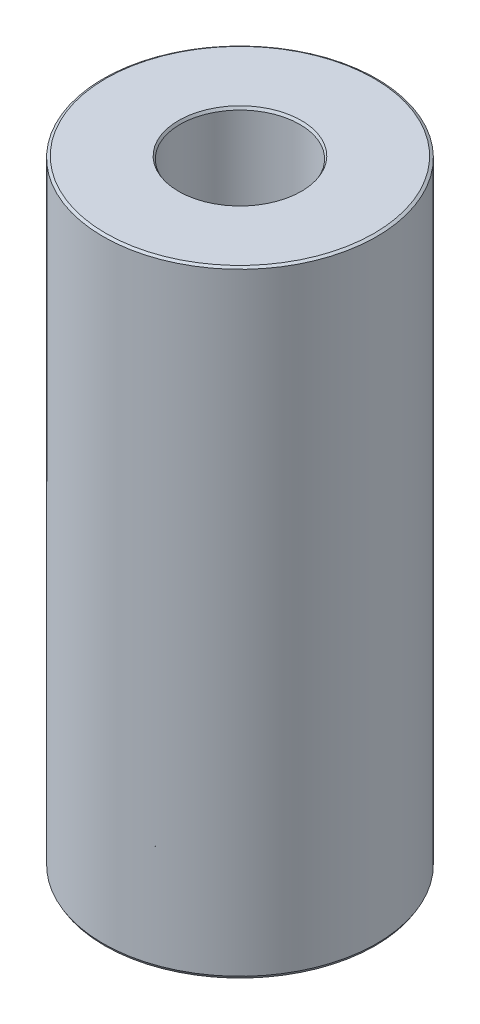
from build123d import *
from OCP.BRepFilletAPI import BRepFilletAPI_MakeChamfer

# Parameters (mm, degrees)
SKETCH1_R           = 32.5
BOSS_EXTRUDE1_DEPTH = 146.475468947
SKETCH2_R           = 14.234179813
CUT_EXTRUDE1_DEPTH  = 154.517305224
CHAMFER1_SIZE       = 0.360597637
CHAMFER1_SIZE2      = 0.624573429


with BuildPart() as part:
    # Sketch1 → Boss-Extrude1 (new body)
    with BuildSketch(Plane(origin=(0, 0, 0), x_dir=(1, 0, 0), z_dir=(0, 1, 0))):
        Circle(SKETCH1_R)
    extrude(amount=BOSS_EXTRUDE1_DEPTH)

    # Sketch2 → Cut-Extrude1 (cut, through all)
    with BuildSketch(Plane(origin=(0, 0, 0), x_dir=(1, 0, 0), z_dir=(0, 1, 0))):
        Circle(SKETCH2_R)
    extrude(amount=CUT_EXTRUDE1_DEPTH, mode=Mode.SUBTRACT)

    # Chamfer1: one chamfer whose edges measure the first distance from different faces: ONE call of the kernel's chamfer builder (chamfer() names one face for all edges)
    chamfer1_edges_1 = [part.edges().sort_by_distance(p)[0] for p in [
        (-14.234179813, 146.475468947, 0),
    ]]
    chamfer1_side_1 = [part.faces().sort_by_distance(p)[0] for p in [
        (-31.580761184, 146.475468947, 0),
    ]]
    chamfer1_edges_2 = [part.edges().sort_by_distance(p)[0] for p in [
        (-14.234179813, 0, 0),
    ]]
    chamfer1_side_2 = [part.faces().sort_by_distance(p)[0] for p in [
        (-14.234179813, 73.237734474, 0),
    ]]
    chamfer1_edges_3 = [part.edges().sort_by_distance(p)[0] for p in [
        (-32.5, 0, 0),
    ]]
    chamfer1_side_3 = [part.faces().sort_by_distance(p)[0] for p in [
        (-31.580761184, 0, 0),
    ]]
    chamfer1_edges_4 = [part.edges().sort_by_distance(p)[0] for p in [
        (-32.5, 146.475468947, 0),
    ]]
    chamfer1_side_4 = [part.faces().sort_by_distance(p)[0] for p in [
        (-32.5, 73.237734474, 0),
    ]]
    chamfer1 = BRepFilletAPI_MakeChamfer(part.part.solid().wrapped)
    for e in chamfer1_edges_1:
        chamfer1.Add(CHAMFER1_SIZE, CHAMFER1_SIZE2, e.wrapped, chamfer1_side_1[0].wrapped)  # the first distance lies on this face
    for e in chamfer1_edges_2:
        chamfer1.Add(CHAMFER1_SIZE, CHAMFER1_SIZE2, e.wrapped, chamfer1_side_2[0].wrapped)  # the first distance lies on this face
    for e in chamfer1_edges_3:
        chamfer1.Add(CHAMFER1_SIZE, CHAMFER1_SIZE2, e.wrapped, chamfer1_side_3[0].wrapped)  # the first distance lies on this face
    for e in chamfer1_edges_4:
        chamfer1.Add(CHAMFER1_SIZE, CHAMFER1_SIZE2, e.wrapped, chamfer1_side_4[0].wrapped)  # the first distance lies on this face
    add(Compound.cast(chamfer1.Shape()), mode=Mode.REPLACE)


solid = part.part
